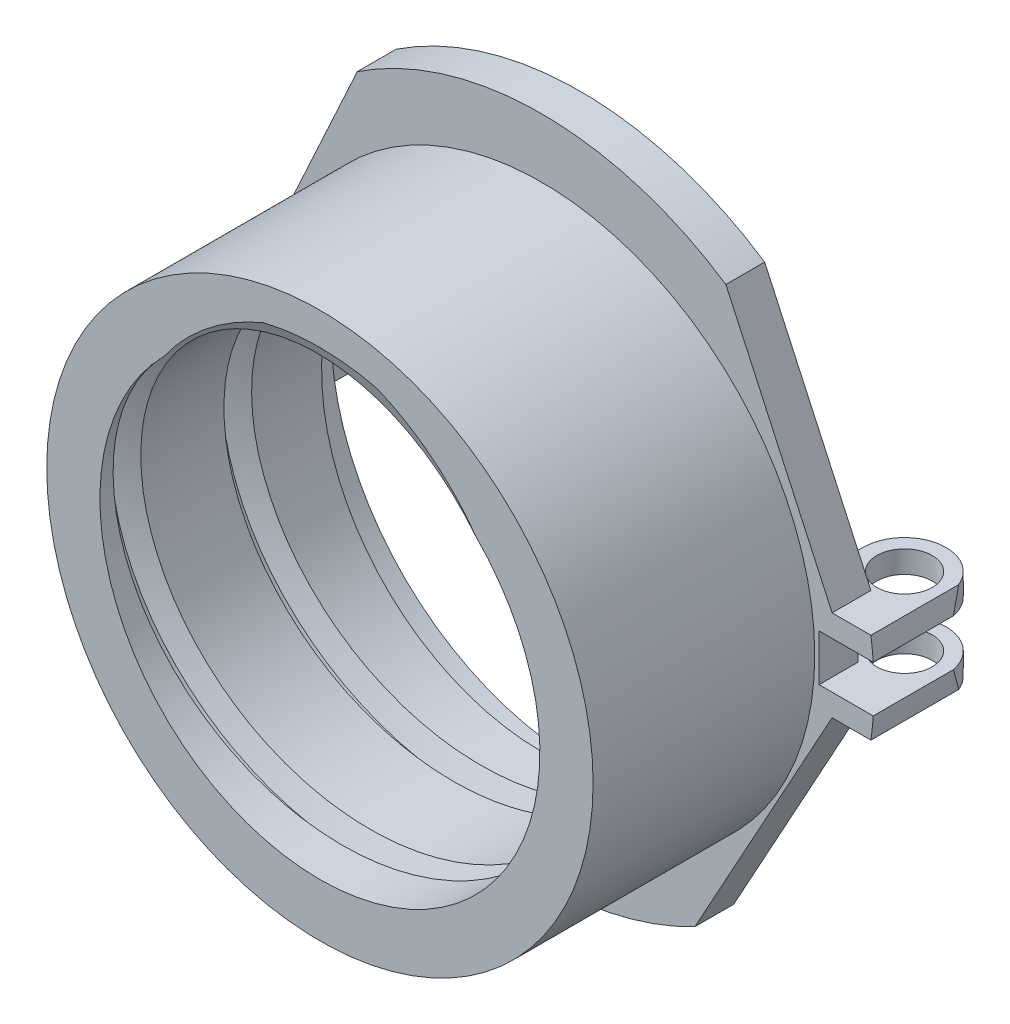
from build123d import *

# Parameters (mm, degrees)
SKETCH2_R           = 24.65
SKETCH2_R_2         = 19.85
BOSS_EXTRUDE1_DEPTH = 20
SKETCH3_R           = 30
SKETCH3_R_2         = 22.5
BOSS_EXTRUDE2_DEPTH = 3.5
CUT_SWEEP1_PITCH    = 10
BOSS_EXTRUDE3_START = 2.1
SKETCH13_R          = 2.5
BOSS_EXTRUDE3_DEPTH = 2
BOSS_EXTRUDE4_START = -4.1
SKETCH13_3_R        = 2.5
BOSS_EXTRUDE4_DEPTH = 2
SKETCH16_R          = 30.278870521
SKETCH16_R_2        = 30
CUT_EXTRUDE1_DEPTH  = 49.500000048
CUT_EXTRUDE2_DEPTH  = 47.904157769


with BuildPart() as part:
    # Sketch2 → Boss-Extrude1 (new body)
    with BuildSketch(Plane.XY):
        Circle(SKETCH2_R)
        Circle(SKETCH2_R_2, mode=Mode.SUBTRACT)
    extrude(amount=BOSS_EXTRUDE1_DEPTH)

    # Sketch3 → Boss-Extrude2 (add)
    with BuildSketch(Plane(origin=(0, 0, 0), x_dir=(-1, 0, 0), z_dir=(0, 0, -1))):
        Circle(SKETCH3_R)
        Circle(SKETCH3_R_2, mode=Mode.SUBTRACT)
    extrude(amount=BOSS_EXTRUDE2_DEPTH)

    # Cut-Sweep1: arcs per turn and ends read off the stored shape
    # Cut-Sweep1: the profile of Sketch12 profile screwed along a left-hand helix through 3.5 turns, 16 arcs to a turn; built about Z, then put on its axis
    cut_sweep1_z = Axis((0, 0, 0), (0, 0, 1))
    cut_sweep1_corners = [(19.8497, 0, -11.250139892), (19.8497, 0, -8.749860108), (21.726443555, 0, -9.625), (21.726443555, 0, -10.375)]
    with BuildLine(mode=Mode.PRIVATE) as cut_sweep1_profile:
        Line(cut_sweep1_corners[0], cut_sweep1_corners[1])
        Line(cut_sweep1_corners[1], cut_sweep1_corners[2])
        Line(cut_sweep1_corners[2], cut_sweep1_corners[3])
        Line(cut_sweep1_corners[3], cut_sweep1_corners[0])
    cut_sweep1_cap = Face(cut_sweep1_profile.wire())
    cut_sweep1_turn_angles = [0, -11.25, -22.5, -33.75, -45, -56.25, -67.5, -78.75, -90, -101.25, -112.5, -123.75, -135, -146.25, -157.5, -168.75, -180, -191.25, -202.5, -213.75, -225, -236.25, -247.5, -258.75, -270, -281.25, -292.5, -303.75, -315, -326.25, -337.5, -348.75, -360]
    cut_sweep1_turn_weights = [1, 0.9807852804032304, 1, 0.9807852804032304, 1, 0.9807852804032304, 1, 0.9807852804032304, 1, 0.9807852804032304, 1, 0.9807852804032304, 1, 0.9807852804032304, 1, 0.9807852804032304, 1, 0.9807852804032304, 1, 0.9807852804032304, 1, 0.9807852804032304, 1, 0.9807852804032304, 1, 0.9807852804032304, 1, 0.9807852804032304, 1, 0.9807852804032304, 1, 0.9807852804032304, 1]
    cut_sweep1_turn_rails = [Edge.make_bspline([Vector(p[0], p[1], 0).rotate(cut_sweep1_z, cut_sweep1_turn_angles[k]) / cut_sweep1_turn_weights[k] + Vector(0, 0, p[2] + -CUT_SWEEP1_PITCH * cut_sweep1_turn_angles[k] / 360) for k in range(33)], [0, 0, 0, 1, 1, 2, 2, 3, 3, 4, 4, 5, 5, 6, 6, 7, 7, 8, 8, 9, 9, 10, 10, 11, 11, 12, 12, 13, 13, 14, 14, 15, 15, 16, 16, 16], 2, cut_sweep1_turn_weights) for p in cut_sweep1_corners]
    cut_sweep1_turn_sides = [Face.make_surface_from_curves(cut_sweep1_turn_rails[p[0]], cut_sweep1_turn_rails[p[1]]) for p in [(0, 1), (1, 2), (2, 3), (3, 0)]]
    cut_sweep1_last_angles = [-1080, -1091.25, -1102.5, -1113.75, -1125, -1136.25, -1147.5, -1158.75, -1170, -1181.25, -1192.5, -1203.75, -1215, -1226.25, -1237.5, -1248.75, -1260]
    cut_sweep1_last_weights = [1, 0.9807852804032304, 1, 0.9807852804032304, 1, 0.9807852804032304, 1, 0.9807852804032304, 1, 0.9807852804032304, 1, 0.9807852804032304, 1, 0.9807852804032304, 1, 0.9807852804032304, 1]
    cut_sweep1_last_rails = [Edge.make_bspline([Vector(p[0], p[1], 0).rotate(cut_sweep1_z, cut_sweep1_last_angles[k]) / cut_sweep1_last_weights[k] + Vector(0, 0, p[2] + -CUT_SWEEP1_PITCH * cut_sweep1_last_angles[k] / 360) for k in range(17)], [0, 0, 0, 1, 1, 2, 2, 3, 3, 4, 4, 5, 5, 6, 6, 7, 7, 8, 8, 8], 2, cut_sweep1_last_weights) for p in cut_sweep1_corners]
    cut_sweep1_last_sides = [Face.make_surface_from_curves(cut_sweep1_last_rails[p[0]], cut_sweep1_last_rails[p[1]]) for p in [(0, 1), (1, 2), (2, 3), (3, 0)]]
    cut_sweep1 = Plane(origin=(0, 0, 20), x_dir=(0, 1, 0), z_dir=(0, 0, -1)) * Solid(Shell([*[p.moved(Location((0, 0, CUT_SWEEP1_PITCH * i))) for i in range(3) for p in cut_sweep1_turn_sides], *cut_sweep1_last_sides, cut_sweep1_cap, cut_sweep1_cap.rotate(cut_sweep1_z, -1260).moved(Location((0, 0, -CUT_SWEEP1_PITCH * -1260 / 360)))]))
    add(cut_sweep1, mode=Mode.SUBTRACT)

    # Sketch13 → Boss-Extrude3 (add)
    with BuildSketch(Plane(origin=(0, 0, 0), x_dir=(1, 0, 0), z_dir=(0, 1, 0)).offset(BOSS_EXTRUDE3_START)):
        with BuildLine():
            ThreePointArc((22.5, 6.5), (26.25, 10.25), (30, 6.5))
            Line((30, 6.5), (30, 3.5))
            Line((30, 3.5), (22.5, 3.5))
            Line((22.5, 3.5), (22.5, 6.5))
        make_face()
        with Locations(Location((26.25, 6.5, 0), (0, 0, 270))):
            Circle(SKETCH13_R, mode=Mode.SUBTRACT)
    boss_extrude3 = extrude(amount=BOSS_EXTRUDE3_DEPTH)

    # Sketch13<3> → Boss-Extrude4 (add)
    with BuildSketch(Plane(origin=(0, 0, 0), x_dir=(1, 0, 0), z_dir=(0, 1, 0)).offset(BOSS_EXTRUDE4_START)):
        with BuildLine():
            ThreePointArc((22.5, 6.5), (26.25, 10.25), (30, 6.5))
            Line((30, 6.5), (30, 3.5))
            Line((30, 3.5), (22.5, 3.5))
            Line((22.5, 3.5), (22.5, 6.5))
        make_face()
        with Locations(Location((26.25, 6.5, 0), (0, 0, 270))):
            Circle(SKETCH13_3_R, mode=Mode.SUBTRACT)
    boss_extrude4 = extrude(amount=BOSS_EXTRUDE4_DEPTH)

    # Mirror1: Boss-Extrude3, Boss-Extrude4 across plane
    add(boss_extrude3.mirror(Plane(origin=(0, 0, 0), x_dir=(0, 0, 1), z_dir=(1, 0, 0))))
    add(boss_extrude4.mirror(Plane(origin=(0, 0, 0), x_dir=(0, 0, 1), z_dir=(1, 0, 0))))

    # Sketch16 → Cut-Extrude1 (cut, through all)
    with BuildSketch(Plane(origin=(0, 0, -3.5), x_dir=(-1, 0, 0), z_dir=(0, 0, -1))):
        Circle(SKETCH16_R)
        with Locations(Location((0, 0, 0), (0, 0, 175.986012782))):
            Circle(SKETCH16_R_2, mode=Mode.SUBTRACT)
    extrude(amount=CUT_EXTRUDE1_DEPTH, mode=Mode.SUBTRACT)

    # Sketch20 → Cut-Extrude2 (cut, through all)
    with BuildSketch(Plane.XY):
        Polygon((29.718512749, 4.1), (26.218512749, 4.1), (16.630564576, 24.96846655), (29.718512749, 24.96846655), align=None)
        Polygon((29.718512749, -4.1), (26.218512749, -4.1), (13.834561845, -26.619633705), (29.718512749, -26.619633705), align=None)
        with BuildLine():
            Line((25.041217897, 2.1), (29.926409741, 2.1))
            ThreePointArc((29.926409741, 2.1), (30, 0), (29.926409741, -2.1))
            Line((29.926409741, -2.1), (26.218512749, -2.1))
            Line((26.218512749, -2.1), (25.041217897, -2.1))
            Line((25.041217897, -2.1), (25.041217897, 2.1))
        make_face()
    cut_extrude2 = extrude(amount=-CUT_EXTRUDE2_DEPTH, mode=Mode.SUBTRACT)

    # Mirror2: Cut-Extrude2 across plane
    add(cut_extrude2.mirror(Plane(origin=(0, 0, 0), x_dir=(0, 0, 1), z_dir=(1, 0, 0))), mode=Mode.SUBTRACT)


solid = part.part
